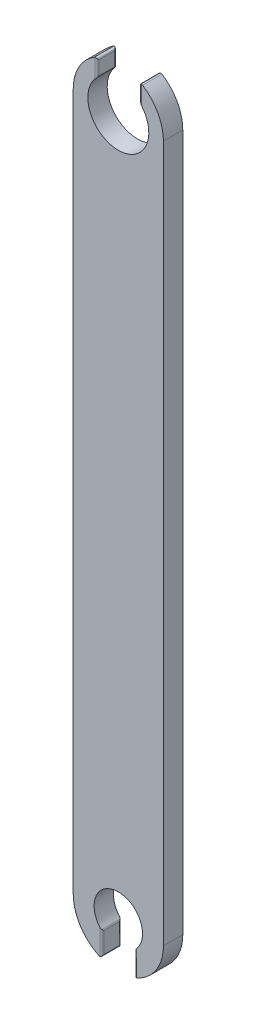
from build123d import *

# Parameters (mm, degrees)
BOSS_EXTRUDE1_DEPTH = 2.54
FILLET1_R           = 0.254


with BuildPart() as part:
    # Sketch1 → Boss-Extrude1 (new body)
    with BuildSketch(Plane.XY):
        with BuildLine():
            Line((-5.9182, 5.510336672), (-5.9182, 96.950336672))
            ThreePointArc((-5.9182, 96.950336672), (-5.077427599, 99.990866267), (-2.794, 102.167486779))
            Line((-2.794, 102.167486779), (-2.794, 99.81277689))
            ThreePointArc((-2.794, 99.81277689), (0, 92.950336672), (2.794, 99.81277689))
            Line((2.794, 99.81277689), (2.794, 102.167486779))
            ThreePointArc((2.794, 102.167486779), (5.077427599, 99.990866267), (5.9182, 96.950336672))
            Line((5.9182, 96.950336672), (5.9182, 5.510336672))
            ThreePointArc((5.9182, 5.510336672), (4.888889702, 2.175093245), (2.159, 0))
            Line((2.159, 0), (2.159, 3.182388219))
            ThreePointArc((2.159, 3.182388219), (0, 8.685336672), (-2.159, 3.182388219))
            Line((-2.159, 3.182388219), (-2.159, 0))
            ThreePointArc((-2.159, 0), (-4.888889702, 2.175093245), (-5.9182, 5.510336672))
        make_face()
    extrude(amount=BOSS_EXTRUDE1_DEPTH)

    # Fillet1
    fillet1_edges = [part.edges().sort_by_distance(p)[0] for p in [
        (2.159, 3.182388219, 1.27),
        (2.159, 1.59119411, 2.54),
        (2.159, 0, 1.27),
        (2.159, 1.59119411, 0),
        (-2.159, 0, 1.27),
        (-2.159, 1.59119411, 2.54),
        (-2.159, 3.182388219, 1.27),
        (-2.159, 1.59119411, 0),
        (2.794, 102.167486779, 1.27),
        (2.794, 100.990131835, 2.54),
        (2.794, 99.81277689, 1.27),
        (2.794, 100.990131835, 0),
        (-2.794, 99.81277689, 1.27),
        (-2.794, 100.990131835, 2.54),
        (-2.794, 102.167486779, 1.27),
        (-2.794, 100.990131835, 0),
    ]]
    fillet(fillet1_edges, radius=FILLET1_R)


solid = part.part
